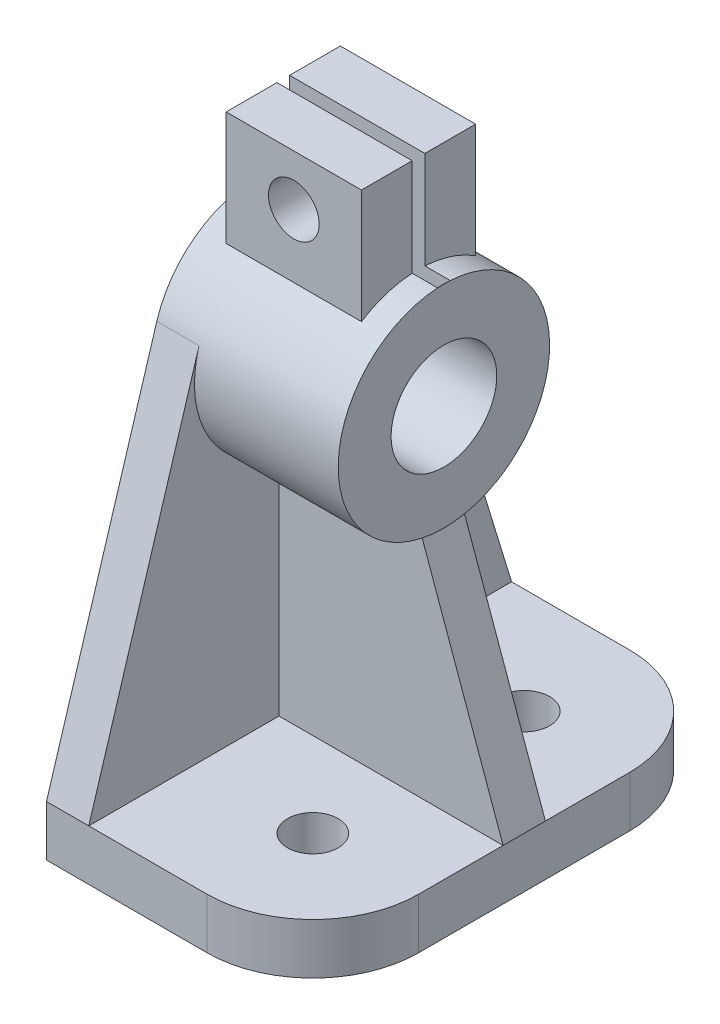
from build123d import *

# Parameters (mm, degrees)
SKETCH1_W               = 63
SKETCH1_H               = 100
BOSS_EXTRUDE1_DEPTH     = 12
FILLET1_R               = 25
SKETCH2_R               = 6
CUT_EXTRUDE1_DEPTH      = 61.301326685
BOSS_EXTRUDE4_DEPTH     = 10
SKETCH5_4_R             = 25
SKETCH5_4_R_2           = 12.5
BOSS_EXTRUDE5_DEPTH     = 44
RIB1_REACH              = 131.295
SKETCH6_WALL_W          = 316.893162762
SKETCH6_WALL_H          = 10
SKETCH5_5_R             = 12.5
CUT_EXTRUDE2_DEPTH      = 141.335312733
BOSS_EXTRUDE6_REACH     = 152.121
SKETCH8_W               = 32
SKETCH8_H               = 27
CUT_EXTRUDE3_REACH      = 152.121
SKETCH9_W               = 43.96081462
SKETCH9_H               = 3
CUT_EXTRUDE4_DEPTH      = 156.140259121
CUT_EXTRUDE4_DEPTH_BACK = 156.140259121
SKETCH10_R              = 6


with BuildPart() as part:
    # Sketch1 → Boss-Extrude1 (new body)
    with BuildSketch(Plane(origin=(0, 0, 0), x_dir=(1, 0, 0), z_dir=(0, 1, 0))):
        Rectangle(SKETCH1_W, SKETCH1_H)
    extrude(amount=BOSS_EXTRUDE1_DEPTH)

    # Fillet1
    fillet1_edges = [part.edges().sort_by_distance(p)[0] for p in [
        (31.5, 6, -50),
        (31.5, 6, 50),
    ]]
    fillet(fillet1_edges, radius=FILLET1_R)

    # Sketch2 → Cut-Extrude1 (cut, through all)
    with BuildSketch(Plane(origin=(0, 12, 0), x_dir=(1, 0, 0), z_dir=(0, 1, 0))):
        with Locations((6.5, 25)):
            Circle(SKETCH2_R)
        with Locations((6.5, -25)):
            Circle(SKETCH2_R)
    extrude(amount=-CUT_EXTRUDE1_DEPTH, mode=Mode.SUBTRACT)

    # Sketch5 → Boss-Extrude4 (add)
    with BuildSketch(Plane.ZY.offset(31.5)):
        with BuildLine():
            Line((-50, 12), (50, 12))
            Line((50, 12), (23.906779363, 97.312038053))
            ThreePointArc((23.906779363, 97.312038053), (0, 115), (-23.906779363, 97.312038053))
            Line((-23.906779363, 97.312038053), (-50, 12))
        make_face()
    extrude(amount=-BOSS_EXTRUDE4_DEPTH)

    # Sketch5<4> → Boss-Extrude5 (add)
    with BuildSketch(Plane.ZY.offset(31.5)):
        with Locations((0, 90)):
            Circle(SKETCH5_4_R)
        with Locations((0, 90)):
            Circle(SKETCH5_4_R_2, mode=Mode.SUBTRACT)
    extrude(amount=-BOSS_EXTRUDE5_DEPTH)

    # Sketch6 wall → Rib1 (add, up to next)
    with BuildSketch(Plane(origin=(22, 38.5, 0), x_dir=(0.33746129583, -0.941339404156, 0), z_dir=(0.941339404156, 0.33746129583, 0)), mode=Mode.PRIVATE) as rib1_sk1:
        Rectangle(SKETCH6_WALL_W, SKETCH6_WALL_H)
    rib1_tool1 = extrude(rib1_sk1.sketch, amount=-RIB1_REACH, mode=Mode.PRIVATE) - part.part
    add(rib1_tool1.solids().sort_by_distance((22, 38.5, 0))[0])

    # Sketch5<5> → Cut-Extrude2 (cut, through all)
    with BuildSketch(Plane.ZY.offset(31.5)):
        with Locations((0, 90)):
            Circle(SKETCH5_5_R)
    extrude(amount=-CUT_EXTRUDE2_DEPTH, mode=Mode.SUBTRACT)

    # Sketch8 → Boss-Extrude6 (add, up to next)
    with BuildSketch(Plane(origin=(0, 138, 0), x_dir=(1, 0, 0), z_dir=(0, 1, 0)), mode=Mode.PRIVATE) as boss_extrude6_sk1:
        with Locations((-9.5, 0)):
            Rectangle(SKETCH8_W, SKETCH8_H)
    boss_extrude6_tool1 = extrude(boss_extrude6_sk1.sketch, amount=-BOSS_EXTRUDE6_REACH, mode=Mode.PRIVATE) - part.part
    add(boss_extrude6_tool1.solids().sort_by_distance((-9.5, 138, 0))[0])

    # Sketch9 → Cut-Extrude3 (cut, up to next)
    with BuildSketch(Plane(origin=(0, 138, 0), x_dir=(1, 0, 0), z_dir=(0, 1, 0)), mode=Mode.PRIVATE) as cut_extrude3_sk1:
        with Locations((-9.5, 0)):
            Rectangle(SKETCH9_W, SKETCH9_H)
    cut_extrude3_tool1 = extrude(cut_extrude3_sk1.sketch, amount=-CUT_EXTRUDE3_REACH, mode=Mode.PRIVATE) & part.part
    add(cut_extrude3_tool1.solids().sort_by_distance((-9.5, 138, 0))[0], mode=Mode.SUBTRACT)

    # Sketch10 → Cut-Extrude4 (cut, two sides: drawn at the far end of the back side and taken through both)
    with BuildSketch(Plane(origin=(0, 0, -13.5), x_dir=(-1, 0, 0), z_dir=(0, 0, -1)).offset(-CUT_EXTRUDE4_DEPTH_BACK)):
        with Locations((9.5, 126)):
            Circle(SKETCH10_R)
    extrude(amount=CUT_EXTRUDE4_DEPTH + CUT_EXTRUDE4_DEPTH_BACK, mode=Mode.SUBTRACT)


solid = part.part
